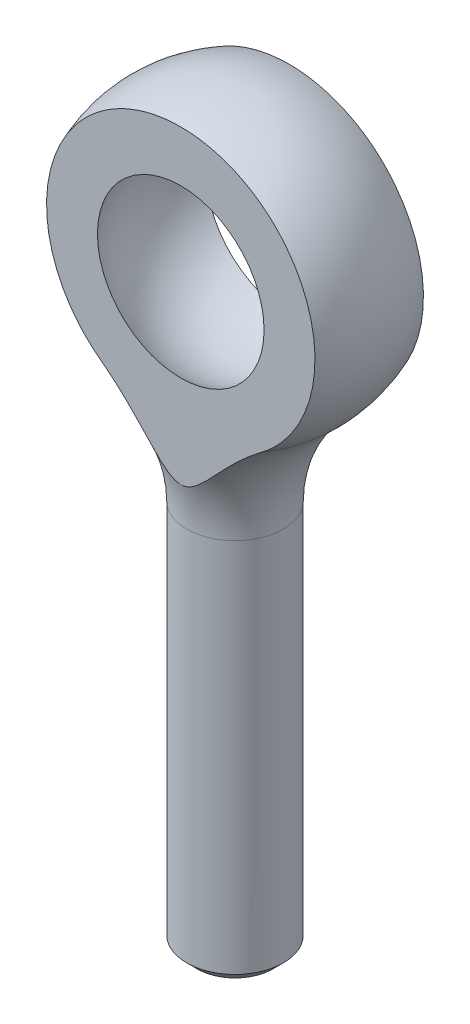
from build123d import *
from OCP.BRepAlgoAPI import BRepAlgoAPI_Cut
from OCP.TopTools import TopTools_ListOfShape

# Parameters (mm, degrees)
SKETCH1_W               = 3.175
SKETCH1_H               = 25.4
CHAMFER2_SIZE           = 0.680357143
CUT_EXTRUDE1_DEPTH      = 29.750847814
CUT_EXTRUDE1_DEPTH_BACK = 29.750847814


with BuildPart() as part:
    # Sketch1 → Revolve1 (revolve)
    with BuildSketch(Plane.XY):
        with Locations((1.5875, -12.7)):
            Rectangle(SKETCH1_W, SKETCH1_H)
    revolve(axis=Axis((0, 23.8125, 0), (0, -1, 0)))

    # Chamfer2
    chamfer2_edges = [part.edges().sort_by_distance(p)[0] for p in [
        (-3.175, -25.4, 0),
    ]]
    chamfer(chamfer2_edges, length=CHAMFER2_SIZE)

    # Sketch4 → Revolve2 (revolve)
    with BuildSketch(Plane.XY):
        with BuildLine():
            Line((0, 7.747), (0, 0))
            Line((0, 0), (3.175, 0))
            ThreePointArc((3.175, 0), (4.01304802, 3.949061991), (6.382731959, 7.217396907))
            ThreePointArc((6.382731959, 7.217396907), (8.890116899, 17.70677573), (0, 23.8125))
            Line((0, 23.8125), (0, 20.828))
            ThreePointArc((0, 20.828), (6.5405, 14.2875), (0, 7.747))
        make_face()
    revolve(axis=Axis((0, 23.8125, 0), (0, 1, 0)))


with BuildPart() as cut_extrude1_tool:
    # Sketch5 → Cut-Extrude1 (new, two sides: drawn at the far end of the back side and taken through both)
    with BuildSketch(Plane(origin=(0, 0, 0), x_dir=(0, 0, -1), z_dir=(1, 0, 0)).offset(-CUT_EXTRUDE1_DEPTH_BACK)):
        Polygon((3.5687, 23.8125), (9.525, 23.8125), (9.525, 0), (3.175, 0), (3.5687, 1.42748), align=None)
        Polygon((-3.5687, 23.8125), (-3.5687, 1.42748), (-3.175, 0), (-9.525, 0), (-9.525, 23.8125), align=None)
    extrude(amount=CUT_EXTRUDE1_DEPTH + CUT_EXTRUDE1_DEPTH_BACK)


with BuildPart() as part_1:
    add(part.part)

    # Cut-Extrude1: cut by cut_extrude1_tool, with a tolerance
    cut_extrude1_stock = TopTools_ListOfShape()
    cut_extrude1_stock.Append(part_1.part.wrapped)
    cut_extrude1_tools = TopTools_ListOfShape()
    cut_extrude1_tools.Append(cut_extrude1_tool.part.wrapped)
    cut_extrude1_cut = BRepAlgoAPI_Cut()
    cut_extrude1_cut.SetArguments(cut_extrude1_stock)
    cut_extrude1_cut.SetTools(cut_extrude1_tools)
    cut_extrude1_cut.SetFuzzyValue(0.00001)
    cut_extrude1_cut.Build()
    add(Compound.cast(cut_extrude1_cut.Shape()).solids(), mode=Mode.REPLACE)


solid = part_1.part
